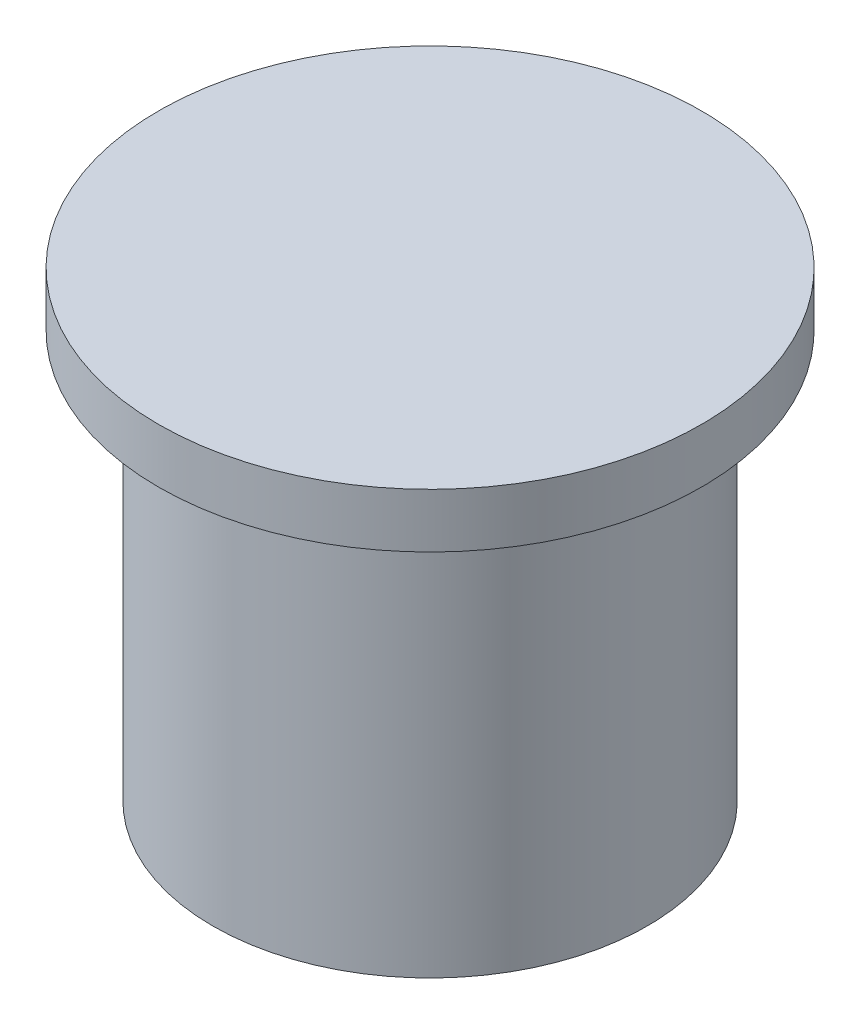
from build123d import *

# Parameters (mm, degrees)
SKETCH_1_R      = 80
EXTRUDE_1_DEPTH = 150
SKETCH_2_R      = 100
EXTRUDE_2_DEPTH = 20


with BuildPart() as part:
    # Эскиз1 → Бобышка-Вытянуть1 (new body)
    with BuildSketch(Plane(origin=(0, 0, 0), x_dir=(1, 0, 0), z_dir=(0, 1, 0))):
        Circle(SKETCH_1_R)
    extrude(amount=EXTRUDE_1_DEPTH)

    # Эскиз2 → Бобышка-Вытянуть2 (add)
    with BuildSketch(Plane(origin=(0, 150, 0), x_dir=(1, 0, 0), z_dir=(0, 1, 0))):
        Circle(SKETCH_2_R)
    extrude(amount=EXTRUDE_2_DEPTH)


solid = part.part
